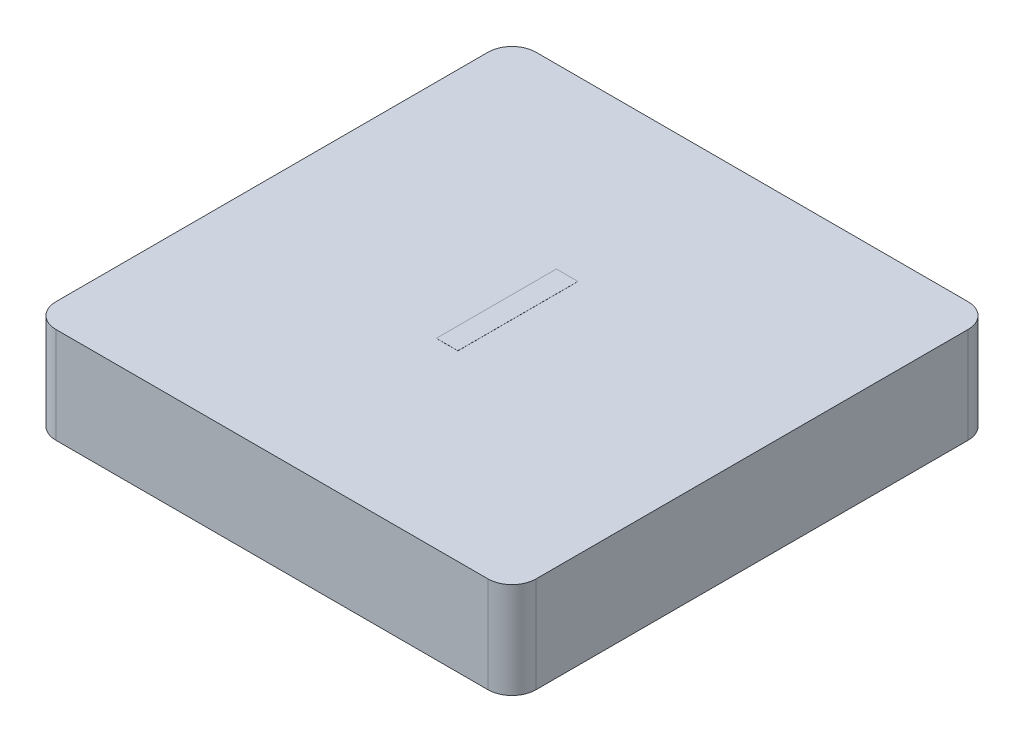
from build123d import *

# Parameters (mm, degrees)
SKETCH1_W           = 12.7
SKETCH1_H           = 12.7
BOSS_EXTRUDE1_DEPTH = 2.54
FILLET1_R           = 0.635
SHELL1_START        = 0.635
SHELL1_OUTLINE_W    = 1.905
SHELL1_OUTLINE_H    = 11.43
SHELL1_DEPTH        = 11.43
SKETCH2_R           = 2.54
BOSS_EXTRUDE2_DEPTH = 1.905
SKETCH3_W           = 0.569871795
SKETCH3_H           = 3.175
BOSS_EXTRUDE3_DEPTH = 0.00254


# Read off the part's stored shape, not the designer's step: Shell1
with BuildPart() as part:
    # Sketch1 → Boss-Extrude1 (new body)
    with BuildSketch(Plane(origin=(0, 0, 0), x_dir=(1, 0, 0), z_dir=(0, 1, 0))):
        with Locations((6.35, 6.35)):
            Rectangle(SKETCH1_W, SKETCH1_H)
    extrude(amount=BOSS_EXTRUDE1_DEPTH)

    # Fillet1
    fillet1_edges = [part.edges().sort_by_distance(p)[0] for p in [
        (0, 1.27, -12.7),
        (12.7, 1.27, -12.7),
        (12.7, 1.27, 0),
        (0, 1.27, 0),
    ]]
    fillet(fillet1_edges, radius=FILLET1_R)

    # Shell1 outline → Shell1 (cut)
    with BuildSketch(Plane.YZ.offset(SHELL1_START)):
        with Locations((0.9525, -6.35)):
            Rectangle(SHELL1_OUTLINE_W, SHELL1_OUTLINE_H)
    extrude(amount=SHELL1_DEPTH, mode=Mode.SUBTRACT)

    # Sketch2 → Boss-Extrude2 (add)
    with BuildSketch(Plane(origin=(0, 1.905, 0), x_dir=(-1, 0, 0), z_dir=(0, -1, 0))):
        with Locations(Location((-6.35, 6.35, 0), (0, 0, 270))):
            Circle(SKETCH2_R)
    extrude(amount=BOSS_EXTRUDE2_DEPTH)

    # Sketch3 → Boss-Extrude3 (add)
    with BuildSketch(Plane(origin=(0, 2.54, 0), x_dir=(1, 0, 0), z_dir=(0, 1, 0))):
        with Locations((6.157871795, 6.4135)):
            Rectangle(SKETCH3_W, SKETCH3_H)
    extrude(amount=BOSS_EXTRUDE3_DEPTH)


solid = part.part
